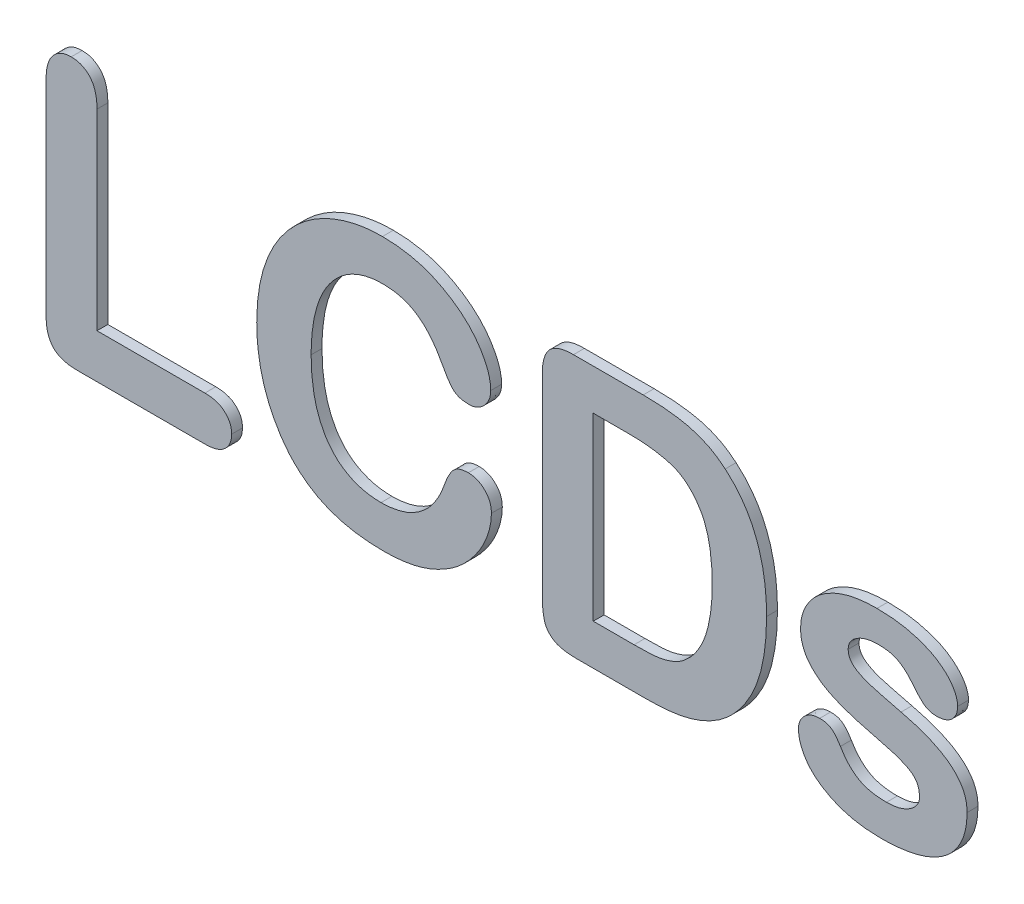
from build123d import *

# Parameters (mm, degrees)
BOSS_EXTRUDE2_DEPTH        = 0.01
BOSS_EXTRUDE2_DEPTH_BACK   = 0.99
BOSS_EXTRUDE2_2_DEPTH      = 0.01
BOSS_EXTRUDE2_2_DEPTH_BACK = 0.99
BOSS_EXTRUDE2_3_DEPTH      = 0.01
BOSS_EXTRUDE2_3_DEPTH_BACK = 0.99
BOSS_EXTRUDE2_4_DEPTH      = 0.01
BOSS_EXTRUDE2_4_DEPTH_BACK = 0.99


with BuildPart() as part:
    # Sketch2 → Boss-Extrude2 (new, two sides: drawn at the far end of the back side and taken through both)
    with BuildSketch(Plane.XY.offset(-BOSS_EXTRUDE2_DEPTH_BACK)):
        with BuildLine():
            Line((-37.1875, 9.208984375), (-37.1875, -8.4375))
            Line((-37.1875, -8.4375), (-27.265625, -8.4375))
            add(Edge.make_bspline(
                [(-27.265625, -8.4375), (-27.079355115, -8.442376333), (-26.724149907, -8.4516752), (-26.227537564, -8.566625541), (-25.792467973, -8.744483914), (-25.44069954, -9.008974062), (-25.157164062, -9.318331803), (-24.951238667, -9.672169849), (-24.830789469, -10.067220414), (-24.816748811, -10.342604282), (-24.809570312, -10.483398438)],
                knots=[0, 0, 0, 0, 1.240270116, 2.365118784, 3.381765818, 4.352609133, 5.275186246, 6.165500839, 7.062084633, 8, 8, 8, 8], degree=3))
            add(Edge.make_bspline(
                [(-24.809570312, -10.483398438), (-24.816456595, -10.627490813), (-24.829777331, -10.906221218), (-24.951382659, -11.304310285), (-25.15486537, -11.655495027), (-25.434806788, -11.958311235), (-25.7861363, -12.208607086), (-26.219219623, -12.374801727), (-26.718073112, -12.485516474), (-27.07612709, -12.494987511), (-27.265625, -12.5)],
                knots=[0, 0, 0, 0, 0.961785517, 1.860465312, 2.752861249, 3.654173772, 4.599371787, 5.609990076, 6.735101654, 8, 8, 8, 8], degree=3))
            Line((-27.265625, -12.5), (-39.00390625, -12.5))
            add(Edge.make_bspline(
                [(-39.00390625, -12.5), (-39.242444814, -12.493758804), (-39.686694697, -12.482135313), (-40.299427435, -12.342474217), (-40.814560024, -12.128335423), (-41.225008405, -11.802865673), (-41.527525719, -11.369333008), (-41.734533688, -10.834208164), (-41.851557434, -10.193798584), (-41.866828038, -9.733584959), (-41.875, -9.487304688)],
                knots=[0, 0, 0, 0, 1.184943227, 2.206816713, 3.109923682, 3.939837529, 4.776053014, 5.71019795, 6.774627611, 8, 8, 8, 8], degree=3))
            Line((-41.875, -9.487304688), (-41.875, 9.208984375))
            add(Edge.make_bspline(
                [(-41.875, 9.208984375), (-41.86896034, 9.442342231), (-41.857586453, 9.881801705), (-41.736438815, 10.494216622), (-41.536977181, 11.016274622), (-41.256131517, 11.446124876), (-40.903275922, 11.777553344), (-40.499565191, 12.01992182), (-40.041406404, 12.159462759), (-39.720989988, 12.177957322), (-39.555664062, 12.1875)],
                knots=[0, 0, 0, 0, 1.312227502, 2.471186598, 3.495416453, 4.440711492, 5.33513045, 6.197779038, 7.0701043, 8, 8, 8, 8], degree=3))
            add(Edge.make_bspline(
                [(-39.555664062, 12.1875), (-39.386820714, 12.180674661), (-39.05889274, 12.167418471), (-38.595232468, 12.017284703), (-38.179374385, 11.785655775), (-37.822222039, 11.4546881), (-37.527175534, 11.031326022), (-37.326530185, 10.505784511), (-37.204272247, 9.888443757), (-37.193341841, 9.445642811), (-37.1875, 9.208984375)],
                knots=[0, 0, 0, 0, 0.937651975, 1.821110013, 2.686129292, 3.571911612, 4.510265029, 5.535848738, 6.683015045, 8, 8, 8, 8], degree=3))
        make_face()
    extrude(amount=BOSS_EXTRUDE2_DEPTH + BOSS_EXTRUDE2_DEPTH_BACK)


with BuildPart() as body_2:
    # Sketch2 → Boss-Extrude2 2 (new, two sides: drawn at the far end of the back side and taken through both)
    with BuildSketch(Plane.XY.offset(-BOSS_EXTRUDE2_2_DEPTH_BACK)):
        with BuildLine():
            add(Edge.make_bspline(
                [(-0.922851562, -4.838867188), (-0.929483854, -5.033018629), (-0.94317771, -5.433887868), (-1.058344362, -6.043675087), (-1.234720937, -6.678120557), (-1.48550785, -7.329853811), (-1.804004332, -7.994632427), (-2.216884396, -8.651806229), (-2.705505576, -9.305985659), (-3.274343575, -9.9490421), (-3.924402421, -10.55946143), (-4.667391974, -11.111012891), (-5.492721111, -11.601375133), (-6.399322763, -12.033332871), (-7.386661778, -12.388503246), (-8.460438143, -12.632626584), (-9.609702978, -12.787867791), (-10.403120104, -12.804142693), (-10.810546875, -12.8125)],
                knots=[0, 0, 0, 0, 0.663733519, 1.370426865, 2.116139696, 2.914458905, 3.756161797, 4.633801399, 5.564768272, 6.546895284, 7.567232022, 8.609557965, 9.705783212, 10.846455846, 12.040496113, 13.287086875, 14.606894913, 16, 16, 16, 16], degree=3))
            add(Edge.make_bspline(
                [(-10.810546875, -12.8125), (-11.121575467, -12.809886595), (-11.729787241, -12.804776121), (-12.620904588, -12.731572766), (-13.470600657, -12.627513212), (-14.278807798, -12.477870558), (-15.047033253, -12.275759235), (-15.77779283, -12.027235675), (-16.476855963, -11.73470644), (-17.13852358, -11.386706898), (-17.769252968, -10.98123199), (-18.373049058, -10.522440579), (-18.956115713, -10.008108657), (-19.311496078, -9.624006046), (-19.4921875, -9.428710938)],
                knots=[0, 0, 0, 0, 1.162398207, 2.273052359, 3.340187725, 4.361698781, 5.343118899, 6.307107414, 7.245071305, 8.173155143, 9.098082292, 10.044846171, 11.00591152, 12, 12, 12, 12], degree=3))
            add(Edge.make_bspline(
                [(-19.4921875, -9.428710938), (-19.649106676, -9.233545763), (-19.963629798, -8.842363745), (-20.396450329, -8.219822434), (-20.782338601, -7.557635421), (-21.14908979, -6.871305541), (-21.462216769, -6.147401554), (-21.741522865, -5.401674845), (-21.977955896, -4.630705003), (-22.16513036, -3.834016791), (-22.32041519, -3.015162962), (-22.41675502, -2.169599578), (-22.492178217, -1.303433191), (-22.49737595, -0.716322062), (-22.5, -0.419921875)],
                knots=[0, 0, 0, 0, 0.929575355, 1.863207229, 2.811429804, 3.773642551, 4.750392879, 5.73698116, 6.729013264, 7.741753443, 8.774044155, 9.821085133, 10.899985467, 12, 12, 12, 12], degree=3))
            add(Edge.make_bspline(
                [(-22.5, -0.419921875), (-22.490400231, 0.057477967), (-22.47166717, 0.989079597), (-22.305155059, 2.346071928), (-22.046969126, 3.629376025), (-21.669176331, 4.831964854), (-21.193295968, 5.956055157), (-20.629847596, 7.000233934), (-19.962832281, 7.955245436), (-19.211953277, 8.824517857), (-18.379566458, 9.60253355), (-17.478579207, 10.284655071), (-16.508757168, 10.86441283), (-15.477400723, 11.342897327), (-14.394691366, 11.715321049), (-13.274735092, 11.993106189), (-12.119112938, 12.156674144), (-11.336771837, 12.177168507), (-10.942382812, 12.1875)],
                knots=[0, 0, 0, 0, 1.192086909, 2.32624733, 3.409866705, 4.457877143, 5.469000883, 6.455088314, 7.416011801, 8.372962001, 9.319325461, 10.256879636, 11.190511563, 12.136385829, 13.091719595, 14.046248446, 15.015086683, 16, 16, 16, 16], degree=3))
            add(Edge.make_bspline(
                [(-10.942382812, 12.1875), (-10.701409734, 12.183372379), (-10.225379124, 12.175218463), (-9.520917377, 12.121754257), (-8.83655016, 12.028161627), (-8.171541888, 11.901128425), (-7.526314136, 11.742231445), (-6.902253411, 11.539488098), (-6.298567901, 11.301904833), (-5.718845327, 11.026411921), (-5.163886561, 10.731287589), (-4.642087318, 10.412837171), (-4.150882509, 10.081762001), (-3.695764811, 9.727719047), (-3.271166808, 9.359946491), (-2.884863762, 8.970044339), (-2.524854461, 8.571041728), (-2.206862741, 8.151228718), (-1.918356748, 7.730988658), (-1.674102617, 7.307919217), (-1.465018229, 6.893400049), (-1.283509185, 6.487233873), (-1.153506535, 6.082029581), (-1.060642692, 5.683417837), (-0.997674751, 5.291700322), (-0.990081958, 5.031155577), (-0.986328125, 4.90234375)],
                knots=[0, 0, 0, 0, 1.284700242, 2.537862918, 3.763812693, 4.965289083, 6.145935712, 7.303948861, 8.460888676, 9.602102237, 10.724019168, 11.810373379, 12.859709494, 13.88027226, 14.88267171, 15.852117704, 16.804758353, 17.745428632, 18.657571087, 19.520770973, 20.347343408, 21.132381758, 21.889741149, 22.611674871, 23.313620019, 24, 24, 24, 24], degree=3))
            add(Edge.make_bspline(
                [(-0.986328125, 4.90234375), (-0.994540451, 4.766647488), (-1.0107345, 4.499065335), (-1.119407491, 4.10740778), (-1.317632933, 3.749150832), (-1.571979061, 3.419846586), (-1.880525497, 3.142702145), (-2.228715314, 2.938106873), (-2.609776408, 2.807500143), (-2.876550334, 2.794645934), (-3.012695312, 2.788085937)],
                knots=[0, 0, 0, 0, 1.005202555, 1.982178884, 2.979908251, 4.019228851, 5.052378826, 6.030321538, 6.994797445, 8, 8, 8, 8], degree=3))
            add(Edge.make_bspline(
                [(-3.012695312, 2.788085937), (-3.159549877, 2.793622997), (-3.437968895, 2.804120613), (-3.828083677, 2.883862613), (-4.15973031, 3.02650108), (-4.440992031, 3.234841156), (-4.682506202, 3.522470799), (-4.934683316, 3.874756634), (-5.203827445, 4.307055603), (-5.376285012, 4.627822207), (-5.46875, 4.799804687)],
                knots=[0, 0, 0, 0, 1.03602979, 1.964190893, 2.792215287, 3.564084538, 4.410155262, 5.430272824, 6.62221301, 8, 8, 8, 8], degree=3))
            add(Edge.make_bspline(
                [(-5.46875, 4.799804687), (-5.628759838, 5.088319714), (-5.937450907, 5.644923064), (-6.481907679, 6.391830527), (-7.069462248, 7.023003311), (-7.702878674, 7.544330529), (-8.401426377, 7.947992921), (-9.170336831, 8.238968365), (-10.017465496, 8.403811461), (-10.60475705, 8.426023383), (-10.908203125, 8.4375)],
                knots=[0, 0, 0, 0, 1.14083101, 2.200891824, 3.189077095, 4.117958574, 5.028926365, 5.968284059, 6.950238216, 8, 8, 8, 8], degree=3))
            add(Edge.make_bspline(
                [(-10.908203125, 8.4375), (-11.152850138, 8.432136818), (-11.633467978, 8.421600653), (-12.333494791, 8.303119598), (-12.997229281, 8.126774663), (-13.620324371, 7.866685871), (-14.208031422, 7.541409973), (-14.754463955, 7.135681215), (-15.259645623, 6.656464104), (-15.728660306, 6.110206882), (-16.148118975, 5.494621182), (-16.508826524, 4.815329882), (-16.819541969, 4.07926038), (-17.063606461, 3.277732944), (-17.268070123, 2.417724202), (-17.398052994, 1.492442421), (-17.483595106, 0.509429365), (-17.494432707, -0.165819118), (-17.5, -0.512695313)],
                knots=[0, 0, 0, 0, 0.93671651, 1.840213212, 2.713397844, 3.56368846, 4.421020421, 5.281885359, 6.164466969, 7.084649485, 8.036264718, 9.013062724, 10.027939462, 11.093339593, 12.220621858, 13.412469407, 14.670781518, 16, 16, 16, 16], degree=3))
            add(Edge.make_bspline(
                [(-17.5, -0.512695313), (-17.496414787, -0.747099378), (-17.489414932, -1.204755337), (-17.457275066, -1.877785212), (-17.393852629, -2.519672937), (-17.304271681, -3.131651455), (-17.200333343, -3.714705038), (-17.063268619, -4.265513707), (-16.900515772, -4.786673012), (-16.718464583, -5.279188829), (-16.503463089, -5.73859735), (-16.283474396, -6.174950652), (-16.034175266, -6.577441157), (-15.756453597, -6.942657642), (-15.470271777, -7.2886102), (-15.157812658, -7.600469881), (-14.823476705, -7.880050233), (-14.353963403, -8.212829064), (-13.717927248, -8.556051522), (-12.891807482, -8.850997457), (-12.003213642, -9.03126844), (-11.389209224, -9.051910443), (-11.07421875, -9.0625)],
                knots=[0, 0, 0, 0, 1.161576005, 2.267888061, 3.337585273, 4.356077319, 5.33204537, 6.270922222, 7.166254778, 8.036538097, 8.870177389, 9.678142996, 10.45692397, 11.2117863, 11.950096439, 12.68003429, 13.395618977, 14.107193223, 15.528992878, 16.960094082, 18.440497528, 20, 20, 20, 20], degree=3))
            add(Edge.make_bspline(
                [(-11.07421875, -9.0625), (-10.901516527, -9.060698668), (-10.561732464, -9.057154626), (-10.06457669, -8.999262902), (-9.585878958, -8.918318458), (-9.129457093, -8.80012487), (-8.689577823, -8.655800697), (-8.275463067, -8.467007967), (-7.87720097, -8.252767984), (-7.500338993, -8.003925569), (-7.148430837, -7.718042675), (-6.816065844, -7.404277495), (-6.500453131, -7.064151091), (-6.219400747, -6.683593151), (-5.953388476, -6.27698229), (-5.710623878, -5.837910591), (-5.489266692, -5.368490041), (-5.365588603, -5.039992198), (-5.302734375, -4.873046875)],
                knots=[0, 0, 0, 0, 1.080453892, 2.125745732, 3.129130718, 4.117609764, 5.07455133, 6.023212249, 6.962414916, 7.903439618, 8.845456672, 9.796903999, 10.763291339, 11.745501622, 12.754406698, 13.803416246, 14.883677954, 16, 16, 16, 16], degree=3))
            add(Edge.make_bspline(
                [(-5.302734375, -4.873046875), (-5.249742048, -4.717544105), (-5.147370537, -4.417141116), (-4.961741996, -3.997877425), (-4.760085362, -3.623676051), (-4.544921421, -3.286892171), (-4.271219253, -3.006429571), (-3.922819326, -2.806560309), (-3.504263141, -2.696100147), (-3.205419969, -2.682824412), (-3.046875, -2.67578125)],
                knots=[0, 0, 0, 0, 1.148264852, 2.218238262, 3.200956292, 4.119438462, 5.004604087, 5.912235567, 6.892380428, 8, 8, 8, 8], degree=3))
            add(Edge.make_bspline(
                [(-3.046875, -2.67578125), (-2.905950398, -2.682785457), (-2.628749401, -2.696562847), (-2.231534522, -2.821346338), (-1.860865215, -3.012136935), (-1.540105798, -3.288312332), (-1.263730263, -3.611046581), (-1.065249999, -3.985931202), (-0.943323489, -4.4000375), (-0.92980108, -4.689899538), (-0.922851562, -4.838867188)],
                knots=[0, 0, 0, 0, 1.000050397, 1.967115494, 2.935635085, 3.946684534, 4.957733984, 5.941906876, 6.942292355, 8, 8, 8, 8], degree=3))
        make_face()
    extrude(amount=BOSS_EXTRUDE2_2_DEPTH + BOSS_EXTRUDE2_2_DEPTH_BACK)


with BuildPart() as body_3:
    # Sketch2 → Boss-Extrude2 3 (new, two sides: drawn at the far end of the back side and taken through both)
    with BuildSketch(Plane.XY.offset(-BOSS_EXTRUDE2_3_DEPTH_BACK)):
        with BuildLine():
            Line((6.62109375, 11.5625), (13.032226563, 11.5625))
            add(Edge.make_bspline(
                [(13.032226563, 11.5625), (13.43437127, 11.556746542), (14.210270273, 11.545645805), (15.329175992, 11.46487553), (16.357904225, 11.322718593), (17.309737085, 11.132670216), (18.197918139, 10.855917284), (19.038898617, 10.489154716), (19.837570162, 10.017860805), (20.32480175, 9.633116314), (20.571289063, 9.438476562)],
                knots=[0, 0, 0, 0, 1.205081575, 2.325087405, 3.359068892, 4.315642998, 5.23043171, 6.141167618, 7.05962871, 8, 8, 8, 8], degree=3))
            add(Edge.make_bspline(
                [(20.571289063, 9.438476562), (20.725852321, 9.300177457), (21.034835941, 9.023707107), (21.468860607, 8.580153867), (21.871704875, 8.108645067), (22.242001704, 7.610054308), (22.584507268, 7.086694746), (22.898057039, 6.537500718), (23.183127791, 5.96140263), (23.428039346, 5.353421056), (23.656589867, 4.725053438), (23.842655524, 4.067567304), (24.013441179, 3.388296866), (24.140407673, 2.677866566), (24.250846439, 1.944064719), (24.321567962, 1.182757454), (24.367074259, 0.396073922), (24.37232728, -0.138279133), (24.375, -0.41015625)],
                knots=[0, 0, 0, 0, 0.912368264, 1.823893017, 2.72801767, 3.638923354, 4.554573881, 5.478337415, 6.419915908, 7.380074035, 8.360841029, 9.360254469, 10.385003032, 11.441221399, 12.53397507, 13.649142366, 14.803891193, 16, 16, 16, 16], degree=3))
            add(Edge.make_bspline(
                [(24.375, -0.41015625), (24.369978564, -0.76669234), (24.360178364, -1.462534072), (24.293354597, -2.484901616), (24.170363762, -3.457551665), (24.005767711, -4.385723816), (23.79205642, -5.267396049), (23.524646319, -6.103697217), (23.200256362, -6.895082007), (22.823758311, -7.642063213), (22.398455393, -8.351910638), (21.910021562, -9.01589958), (21.375587574, -9.65184071), (20.973753298, -10.036079965), (20.771484375, -10.229492188)],
                knots=[0, 0, 0, 0, 1.189908064, 2.322311019, 3.417156475, 4.460275639, 5.466815511, 6.442543353, 7.387719066, 8.318122672, 9.231999599, 10.14574737, 11.066635914, 12, 12, 12, 12], degree=3))
            add(Edge.make_bspline(
                [(20.771484375, -10.229492188), (20.607534681, -10.365650991), (20.282352332, -10.635712121), (19.759565585, -10.992026656), (19.217922184, -11.311856086), (18.649618173, -11.584017116), (18.061521466, -11.817892692), (17.454296548, -12.020441628), (16.824189422, -12.180412099), (16.170006751, -12.302824333), (15.484872849, -12.388677199), (14.761694622, -12.45167921), (13.994570808, -12.491079197), (13.468472134, -12.496972772), (13.198242188, -12.5)],
                knots=[0, 0, 0, 0, 0.947611896, 1.879519589, 2.810892682, 3.743559544, 4.679368975, 5.625014783, 6.589135788, 7.569006511, 8.583859636, 9.659600976, 10.79785688, 12, 12, 12, 12], degree=3))
            Line((13.198242188, -12.5), (6.840820313, -12.5))
            add(Edge.make_bspline(
                [(6.840820313, -12.5), (6.632111202, -12.496771029), (6.240680916, -12.490715149), (5.694784265, -12.409199901), (5.225719298, -12.29661688), (4.836951054, -12.116776322), (4.523670482, -11.887300201), (4.268923122, -11.62012712), (4.074577662, -11.311385814), (3.941540512, -10.956945361), (3.860646048, -10.557514159), (3.796359171, -10.109164896), (3.758626738, -9.606743508), (3.752968681, -9.2529906), (3.75, -9.067382813)],
                knots=[0, 0, 0, 0, 1.377042754, 2.582619597, 3.638634442, 4.552380029, 5.390944887, 6.189413518, 6.976805938, 7.783338659, 8.675325277, 9.663502231, 10.774081652, 12, 12, 12, 12], degree=3))
            Line((3.75, -9.067382813), (3.75, 8.57421875))
            add(Edge.make_bspline(
                [(3.75, 8.57421875), (3.757466048, 8.819030874), (3.771421559, 9.27663282), (3.897003158, 9.910687989), (4.101231541, 10.443573937), (4.41026646, 10.869862711), (4.822700259, 11.189225301), (5.333182032, 11.412917127), (5.945908106, 11.541509778), (6.386066788, 11.555193464), (6.62109375, 11.5625)],
                knots=[0, 0, 0, 0, 1.223933238, 2.287771624, 3.219464999, 4.058429984, 4.887811936, 5.799168462, 6.824844833, 8, 8, 8, 8], degree=3))
        make_face()
        with BuildLine():
            Line((8.4375, 7.8125), (8.4375, -8.75))
            Line((8.4375, -8.75), (12.192382813, -8.75))
            add(Edge.make_bspline(
                [(12.192382813, -8.75), (12.387696003, -8.748676336), (12.755560562, -8.746183268), (13.274917148, -8.738096686), (13.725955725, -8.719192778), (14.246075533, -8.682420256), (14.865159075, -8.580958141), (15.470294624, -8.405411826), (15.948027436, -8.214226192), (16.287150239, -8.040594032), (16.601434691, -7.837601438), (16.790211, -7.680985261), (16.884765625, -7.602539063)],
                knots=[0, 0, 0, 0, 1.184958505, 2.231821799, 3.150981766, 3.923453378, 5.394195509, 6.947227249, 7.73568962, 8.512942825, 9.255160071, 10, 10, 10, 10], degree=3))
            add(Edge.make_bspline(
                [(16.884765625, -7.602539063), (17.086744605, -7.418284356), (17.495284976, -7.045594653), (17.994622871, -6.360160815), (18.427486769, -5.594236384), (18.780178313, -4.731472113), (19.043101552, -3.773098843), (19.23729409, -2.724590768), (19.354765512, -1.581436465), (19.368083075, -0.788049058), (19.375, -0.375976563)],
                knots=[0, 0, 0, 0, 0.830198868, 1.679232924, 2.566452626, 3.503820563, 4.5074435, 5.585855826, 6.746132842, 8, 8, 8, 8], degree=3))
            add(Edge.make_bspline(
                [(19.375, -0.375976563), (19.373390853, -0.084514924), (19.370268423, 0.481044555), (19.312052771, 1.300107333), (19.235493364, 2.064042051), (19.109383298, 2.768797422), (18.964316226, 3.420554605), (18.771067984, 4.011546995), (18.554665398, 4.550797795), (18.292531899, 5.029666004), (18.008260649, 5.459961766), (17.709305694, 5.848276497), (17.395998282, 6.196047227), (17.069510673, 6.507464232), (16.720231452, 6.771036192), (16.357572405, 6.99670557), (15.979919268, 7.1865498), (15.439613151, 7.372353034), (14.717461557, 7.549313843), (13.789037557, 7.706231362), (12.776923436, 7.798147498), (12.073760141, 7.807597618), (11.708984375, 7.8125)],
                knots=[0, 0, 0, 0, 1.332707943, 2.586019949, 3.754198126, 4.842205301, 5.858829369, 6.805215834, 7.683069408, 8.512460463, 9.297043483, 10.040052763, 10.751631204, 11.436259444, 12.100301596, 12.748934639, 13.388143941, 14.0286091, 15.357465128, 16.784452386, 18.331889833, 20, 20, 20, 20], degree=3))
            Line((11.708984375, 7.8125), (8.4375, 7.8125))
        make_face(mode=Mode.SUBTRACT)
    extrude(amount=BOSS_EXTRUDE2_3_DEPTH + BOSS_EXTRUDE2_3_DEPTH_BACK)


with BuildPart() as body_4:
    # Sketch2 → Boss-Extrude2 4 (new, two sides: drawn at the far end of the back side and taken through both)
    with BuildSketch(Plane.XY.offset(-BOSS_EXTRUDE2_4_DEPTH_BACK)):
        with BuildLine():
            add(Edge.make_bspline(
                [(42.8125, -6.796875), (42.801691721, -7.103742656), (42.78070039, -7.699726576), (42.605321308, -8.558382022), (42.323502466, -9.35157308), (41.916608532, -10.069673196), (41.407192723, -10.719133877), (40.773423709, -11.274006217), (40.03868143, -11.751293642), (39.195430096, -12.139204918), (38.253829333, -12.447721497), (37.211119716, -12.655245033), (36.076127821, -12.790184237), (35.286878907, -12.804883552), (34.877929688, -12.8125)],
                knots=[0, 0, 0, 0, 0.978330543, 1.900067542, 2.783908492, 3.653537173, 4.522188368, 5.405021743, 6.328352065, 7.308789286, 8.358212084, 9.482658207, 10.695639685, 12, 12, 12, 12], degree=3))
            add(Edge.make_bspline(
                [(34.877929688, -12.8125), (34.485190161, -12.803622456), (33.727913971, -12.786504869), (32.634139633, -12.641552074), (31.625925313, -12.413014564), (30.71140144, -12.085591543), (29.901362843, -11.686045204), (29.19719301, -11.237133431), (28.600695659, -10.742851483), (28.125263305, -10.199075523), (27.762724732, -9.629453322), (27.499319209, -9.056950206), (27.338706123, -8.478664459), (27.315945456, -8.091761735), (27.3046875, -7.900390625)],
                knots=[0, 0, 0, 0, 1.420034992, 2.738096412, 3.98334611, 5.152780846, 6.24278678, 7.243835082, 8.167224378, 9.035061691, 9.845102135, 10.601280252, 11.308160595, 12, 12, 12, 12], degree=3))
            add(Edge.make_bspline(
                [(27.3046875, -7.900390625), (27.311133652, -7.779274861), (27.323834694, -7.540636953), (27.428990725, -7.195489891), (27.612377966, -6.884472012), (27.848853328, -6.599580609), (28.146790262, -6.368654193), (28.482642122, -6.192008108), (28.860124888, -6.093445078), (29.122170111, -6.080776422), (29.2578125, -6.07421875)],
                knots=[0, 0, 0, 0, 0.974890805, 1.920855672, 2.872531461, 3.868371282, 4.886419525, 5.889488144, 6.907536387, 8, 8, 8, 8], degree=3))
            add(Edge.make_bspline(
                [(29.2578125, -6.07421875), (29.375327859, -6.077105349), (29.59767385, -6.082566966), (29.910017742, -6.145913873), (30.17942709, -6.252394017), (30.487330468, -6.462636219), (30.824763283, -6.831354704), (31.044029243, -7.17391907), (31.162109375, -7.358398438)],
                knots=[0, 0, 0, 0, 0.867702666, 1.641744625, 2.343375543, 2.994152543, 4.381276941, 6, 6, 6, 6], degree=3))
            add(Edge.make_bspline(
                [(31.162109375, -7.358398438), (31.276669149, -7.543643141), (31.500177428, -7.905059049), (31.896998164, -8.382952973), (32.325331037, -8.789844983), (32.793219338, -9.126790928), (33.32681105, -9.391281341), (33.944152971, -9.555253245), (34.64058662, -9.674857518), (35.134474029, -9.683128531), (35.395507813, -9.6875)],
                knots=[0, 0, 0, 0, 1.021524188, 1.993012951, 2.906519413, 3.788549777, 4.690705095, 5.684651437, 6.7762713, 8, 8, 8, 8], degree=3))
            add(Edge.make_bspline(
                [(35.395507813, -9.6875), (35.607474229, -9.679478686), (36.01638685, -9.664004459), (36.600932369, -9.561028531), (37.123503327, -9.37072392), (37.578536705, -9.120848663), (37.956217198, -8.825498566), (38.227650566, -8.491192751), (38.406046271, -8.134688111), (38.427129069, -7.882730586), (38.4375, -7.758789063)],
                knots=[0, 0, 0, 0, 1.287398257, 2.483569818, 3.587304266, 4.649126193, 5.626279563, 6.476852022, 7.250741643, 8, 8, 8, 8], degree=3))
            add(Edge.make_bspline(
                [(38.4375, -7.758789063), (38.428942439, -7.578260908), (38.412646982, -7.234496064), (38.240547364, -6.756643049), (37.952039468, -6.36038064), (37.537545565, -6.048802214), (37.006566426, -5.791860657), (36.351401747, -5.530803391), (35.550723059, -5.289202102), (34.966479502, -5.142246131), (34.653320313, -5.063476563)],
                knots=[0, 0, 0, 0, 0.851246659, 1.620958665, 2.364855448, 3.138141184, 4.04731938, 5.149766564, 6.472252226, 8, 8, 8, 8], degree=3))
            add(Edge.make_bspline(
                [(34.653320313, -5.063476563), (34.275012678, -4.971788048), (33.551202028, -4.796361708), (32.527272126, -4.502924464), (31.611989337, -4.207694669), (30.799612329, -3.901653719), (30.080740374, -3.562270923), (29.43819611, -3.182419255), (28.876105457, -2.74568815), (28.383525258, -2.267485084), (27.984263392, -1.727216161), (27.706097639, -1.120230563), (27.524876981, -0.457987769), (27.50846354, 0.005265511), (27.5, 0.244140625)],
                knots=[0, 0, 0, 0, 1.448277539, 2.770968941, 3.962207399, 5.026184992, 5.998688844, 6.916835692, 7.797506204, 8.641144264, 9.464874875, 10.280394041, 11.113290533, 12, 12, 12, 12], degree=3))
            add(Edge.make_bspline(
                [(27.5, 0.244140625), (27.508454466, 0.461639713), (27.525395417, 0.897461626), (27.692701107, 1.534804864), (27.942867893, 2.157073174), (28.30173197, 2.750675927), (28.758015328, 3.309976323), (29.313032022, 3.817545681), (29.974240702, 4.24941891), (30.716346639, 4.632203202), (31.551467458, 4.94104475), (32.471641905, 5.155190268), (33.472578493, 5.290200364), (34.166205131, 5.304878469), (34.526367188, 5.3125)],
                knots=[0, 0, 0, 0, 0.810009447, 1.623086649, 2.442984974, 3.306420084, 4.19991711, 5.128494262, 6.10038872, 7.137956519, 8.239007839, 9.413013131, 10.656720404, 12, 12, 12, 12], degree=3))
            add(Edge.make_bspline(
                [(34.526367188, 5.3125), (34.811265138, 5.306882693), (35.368748394, 5.295890845), (36.18355931, 5.237423421), (36.952277186, 5.116138078), (37.675403757, 4.96273354), (38.345648419, 4.768675567), (38.96055438, 4.542947343), (39.520042381, 4.291885184), (40.019556768, 4.003654385), (40.457013431, 3.688102353), (40.851211446, 3.368927151), (41.17583861, 3.018968921), (41.453489515, 2.663707909), (41.66708284, 2.300014304), (41.823129154, 1.936454702), (41.92122393, 1.575822637), (41.932833744, 1.333566276), (41.938476563, 1.215820312)],
                knots=[0, 0, 0, 0, 1.481499756, 2.898972446, 4.242980689, 5.524335581, 6.740194739, 7.867328329, 8.92764642, 9.924793649, 10.859327534, 11.730447187, 12.556547516, 13.33512139, 14.070948804, 14.742086554, 15.388605403, 16, 16, 16, 16], degree=3))
            add(Edge.make_bspline(
                [(41.938476563, 1.215820312), (41.931376214, 1.093265539), (41.917620568, 0.855837718), (41.825814401, 0.512853306), (41.652721487, 0.212262245), (41.427801455, -0.055089944), (41.140008253, -0.275414014), (40.79034909, -0.423046494), (40.390949668, -0.519966235), (40.106440664, -0.527986961), (39.956054688, -0.532226563)],
                knots=[0, 0, 0, 0, 0.987102071, 1.912332652, 2.827485795, 3.757067812, 4.711083095, 5.714319442, 6.791833303, 8, 8, 8, 8], degree=3))
            add(Edge.make_bspline(
                [(39.956054688, -0.532226563), (39.84479293, -0.528479269), (39.629045179, -0.521212889), (39.319344749, -0.437113874), (39.033420782, -0.312231384), (38.771155179, -0.126663058), (38.522074292, 0.112246347), (38.253354179, 0.390858725), (37.963909939, 0.717856063), (37.77527389, 0.960754723), (37.67578125, 1.088867187)],
                knots=[0, 0, 0, 0, 0.914451201, 1.773212947, 2.625667911, 3.473892303, 4.404042966, 5.466357244, 6.663676377, 8, 8, 8, 8], degree=3))
            add(Edge.make_bspline(
                [(37.67578125, 1.088867187), (37.589575366, 1.19127868), (37.418837658, 1.394112904), (37.134874266, 1.670056106), (36.824220837, 1.907848899), (36.493364466, 2.125842107), (36.115845855, 2.301980158), (35.678936378, 2.412997664), (35.186558194, 2.48876043), (34.837577848, 2.496116226), (34.653320313, 2.5)],
                knots=[0, 0, 0, 0, 0.924615356, 1.831275306, 2.728822865, 3.624113149, 4.565065848, 5.590834487, 6.727988824, 8, 8, 8, 8], degree=3))
            add(Edge.make_bspline(
                [(34.653320313, 2.5), (34.462339007, 2.495874446), (34.093907896, 2.487915644), (33.567909283, 2.384930482), (33.086653128, 2.234387907), (32.670997439, 2.008147469), (32.320740423, 1.748040502), (32.066583659, 1.4403594), (31.901140806, 1.099141958), (31.883711259, 0.854629041), (31.875, 0.732421875)],
                knots=[0, 0, 0, 0, 1.260110453, 2.430938959, 3.529583093, 4.578614181, 5.544624012, 6.392988612, 7.196818271, 8, 8, 8, 8], degree=3))
            add(Edge.make_bspline(
                [(31.875, 0.732421875), (31.8803021, 0.622221269), (31.890735296, 0.405374261), (32.012523243, 0.10014749), (32.197280876, -0.176235852), (32.458322121, -0.415401279), (32.779669119, -0.621289875), (33.148976553, -0.810572546), (33.564892508, -0.989308297), (34.045210684, -1.137256822), (34.594379051, -1.286946124), (35.22630755, -1.461017022), (35.951348357, -1.643857302), (36.466383085, -1.769570655), (36.73828125, -1.8359375)],
                knots=[0, 0, 0, 0, 0.673313821, 1.32491183, 1.987456721, 2.701596388, 3.480569876, 4.325492209, 5.24812857, 6.256441115, 7.408347065, 8.744323962, 10.281256987, 12, 12, 12, 12], degree=3))
            add(Edge.make_bspline(
                [(36.73828125, -1.8359375), (37.06981448, -1.918184231), (37.706686247, -2.076179316), (38.60321812, -2.366889756), (39.410589981, -2.670070523), (40.121602494, -3.008429312), (40.748405463, -3.368727987), (41.290306143, -3.761387196), (41.756045946, -4.182541674), (42.139663463, -4.638516462), (42.446641734, -5.127448927), (42.65459454, -5.656070675), (42.787847198, -6.215779755), (42.80418137, -6.600795212), (42.8125, -6.796875)],
                knots=[0, 0, 0, 0, 1.447783026, 2.781175617, 3.993507337, 5.101610811, 6.115908563, 7.054494823, 7.933667828, 8.77126253, 9.573695554, 10.369454431, 11.169599495, 12, 12, 12, 12], degree=3))
        make_face()
    extrude(amount=BOSS_EXTRUDE2_4_DEPTH + BOSS_EXTRUDE2_4_DEPTH_BACK)


solid = Compound([part.part, body_2.part, body_3.part, body_4.part])
